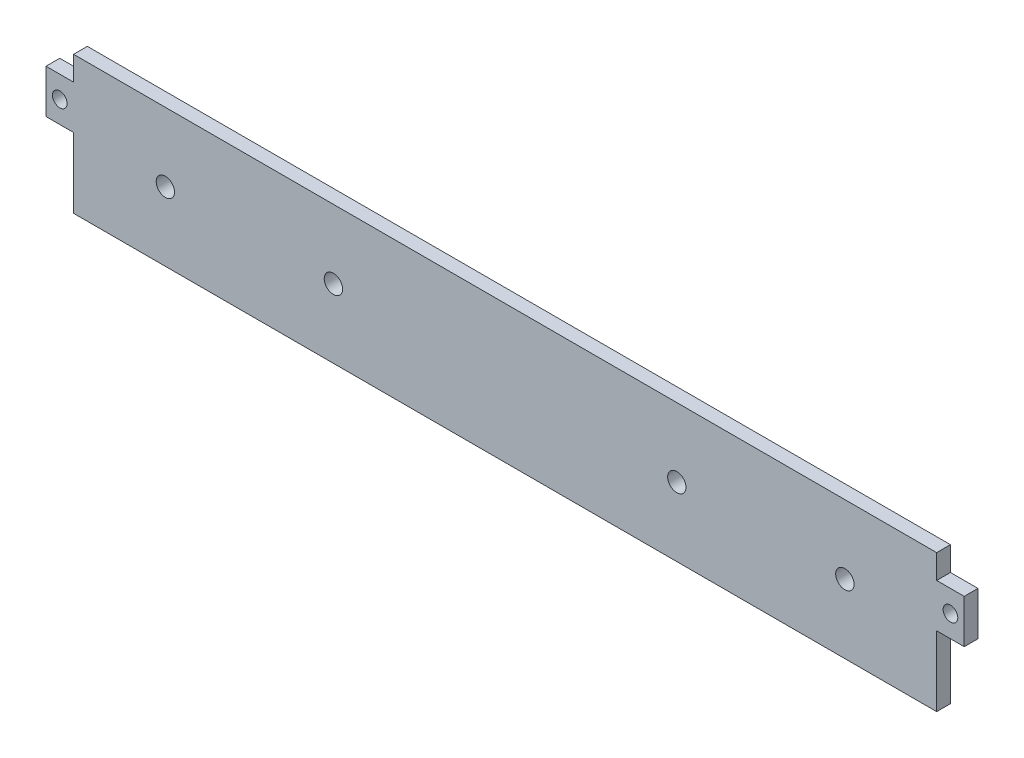
from build123d import *

# Parameters (mm, degrees)
ESBO_O1_R                = 1.6
ESBO_O1_R_2              = 2
RESSALTO_EXTRUS_O1_DEPTH = 3


with BuildPart() as part:
    # Esboço1 → Ressalto-extrusão1 (new body)
    with BuildSketch(Plane.XY):
        Polygon((-94, 0.25), (-94, -15), (94, -15), (94, 0.25), (100, 0.25), (100, 9.75), (94, 9.75), (94, 15), (-94, 15), (-94, 9.75), (-100, 9.75), (-100, 0.25), align=None)
        with Locations((-97, 5)):
            Circle(ESBO_O1_R, mode=Mode.SUBTRACT)
        with Locations((97, 5)):
            Circle(ESBO_O1_R, mode=Mode.SUBTRACT)
        with Locations((-74, 0)):
            Circle(ESBO_O1_R_2, mode=Mode.SUBTRACT)
        with Locations((-37.4, 0)):
            Circle(ESBO_O1_R_2, mode=Mode.SUBTRACT)
        with Locations((37.4, 0)):
            Circle(ESBO_O1_R_2, mode=Mode.SUBTRACT)
        with Locations((74, 0)):
            Circle(ESBO_O1_R_2, mode=Mode.SUBTRACT)
    extrude(amount=RESSALTO_EXTRUS_O1_DEPTH)


solid = part.part
